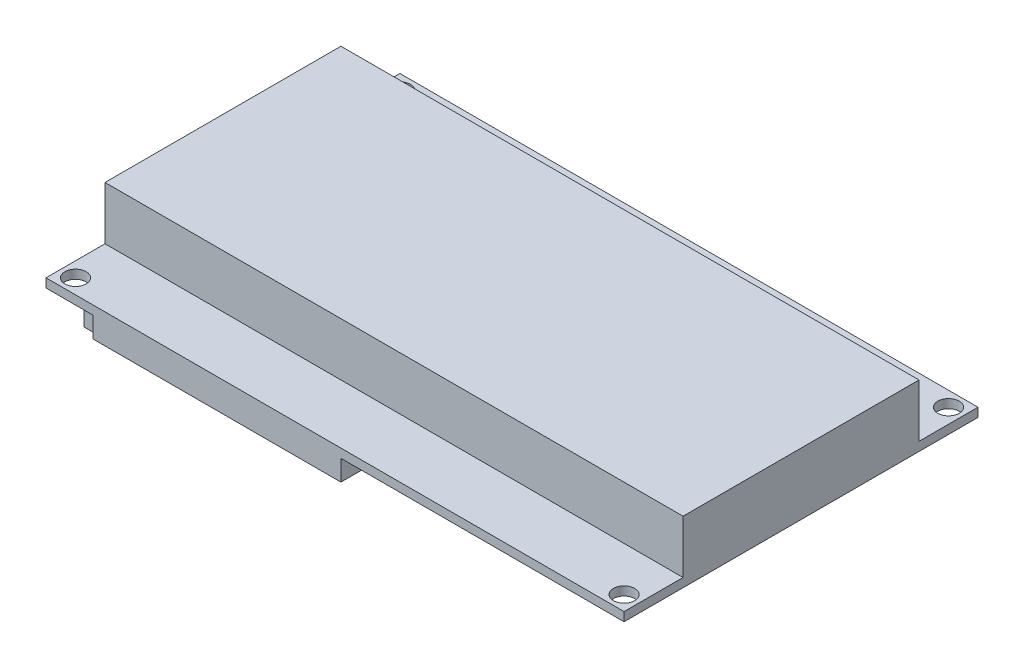
from build123d import *

# Parameters (mm, degrees)
SKIZZE1_W                            = 49
SKIZZE1_H                            = 30
AUFSATZ_LINEAR_AUSTRAGEN1_DEPTH      = 1.5
SKIZZE2_W                            = 49
SKIZZE2_H                            = 20
AUFSATZ_LINEAR_AUSTRAGEN2_DEPTH      = 9
SCHNITT_LINEAR_AUSTRAGEN1_DEPTH      = 59.154965394
SCHNITT_LINEAR_AUSTRAGEN1_DEPTH_BACK = 59.154965394
SKIZZE3_R                            = 1.8
SKIZZE4_W                            = 42
SKIZZE4_H                            = 20.4
AUFSATZ_LINEAR_AUSTRAGEN3_DEPTH      = 3.5
SKIZZE5_W                            = 9.3
SKIZZE5_H                            = 10
SKIZZE5_W_2                          = 5.202111929
SKIZZE5_H_2                          = 5.340958118
SKIZZE5_W_3                          = 5.892281305
SKIZZE5_H_3                          = 9.90280044
SKIZZE5_H_4                          = 4.8
AUFSATZ_LINEAR_AUSTRAGEN4_DEPTH      = 4.2


with BuildPart() as part:
    # Skizze1 → Aufsatz-Linear austragen1 (new body)
    with BuildSketch(Plane(origin=(0, 0, 0), x_dir=(1, 0, 0), z_dir=(0, 1, 0))):
        with Locations((-24.5, -15)):
            Rectangle(SKIZZE1_W, SKIZZE1_H)
    extrude(amount=AUFSATZ_LINEAR_AUSTRAGEN1_DEPTH)

    # Skizze2 → Aufsatz-Linear austragen2 (add)
    with BuildSketch(Plane(origin=(0, 1.5, 0), x_dir=(1, 0, 0), z_dir=(0, 1, 0))):
        with Locations((-24.5, -10)):
            Rectangle(SKIZZE2_W, SKIZZE2_H)
    extrude(amount=AUFSATZ_LINEAR_AUSTRAGEN2_DEPTH)

    # Skizze3 → Schnitt-Linear austragen1 (cut, two sides: drawn at the far end of the back side and taken through both)
    with BuildSketch(Plane(origin=(0, 1.5, 0), x_dir=(1, 0, 0), z_dir=(0, 1, 0)).offset(-SCHNITT_LINEAR_AUSTRAGEN1_DEPTH_BACK)):
        with Locations((-46.5, -27.5)):
            Circle(SKIZZE3_R)
    extrude(amount=SCHNITT_LINEAR_AUSTRAGEN1_DEPTH + SCHNITT_LINEAR_AUSTRAGEN1_DEPTH_BACK, mode=Mode.SUBTRACT)

    # Spiegeln1: part across plane


with BuildPart() as part_1:
    add(part.part)
    add(part.part.mirror(Plane(origin=(0, 1.5, 0), x_dir=(0, 0, 1), z_dir=(-1, 0, 0))))

    # Spiegeln2: part across plane


with BuildPart() as part_2:
    add(part_1.part)
    add(part_1.part.mirror(Plane(origin=(0, 1.5, 0), x_dir=(1, 0, 0), z_dir=(0, 0, 1))))

    # Skizze4 → Aufsatz-Linear austragen3 (add)
    with BuildSketch(Plane.XZ):
        with Locations((-20, 19.8)):
            Rectangle(SKIZZE4_W, SKIZZE4_H)
    extrude(amount=AUFSATZ_LINEAR_AUSTRAGEN3_DEPTH)

    # Skizze5 → Aufsatz-Linear austragen4 (add)
    with BuildSketch(Plane.XZ.offset(3.5)):
        with Locations((-43.15, 19.8)):
            Rectangle(SKIZZE5_W, SKIZZE5_H)
        with Locations((-28.561234427, 15.050145035)):
            Rectangle(SKIZZE5_W_2, SKIZZE5_H_2)
        with Locations((-17.866219882, 19.8)):
            Rectangle(SKIZZE5_W_3, SKIZZE5_H_3)
        with Locations((3.15, 17.4)):
            Rectangle(SKIZZE5_W, SKIZZE5_H_4)
    extrude(amount=AUFSATZ_LINEAR_AUSTRAGEN4_DEPTH)


solid = part_2.part
